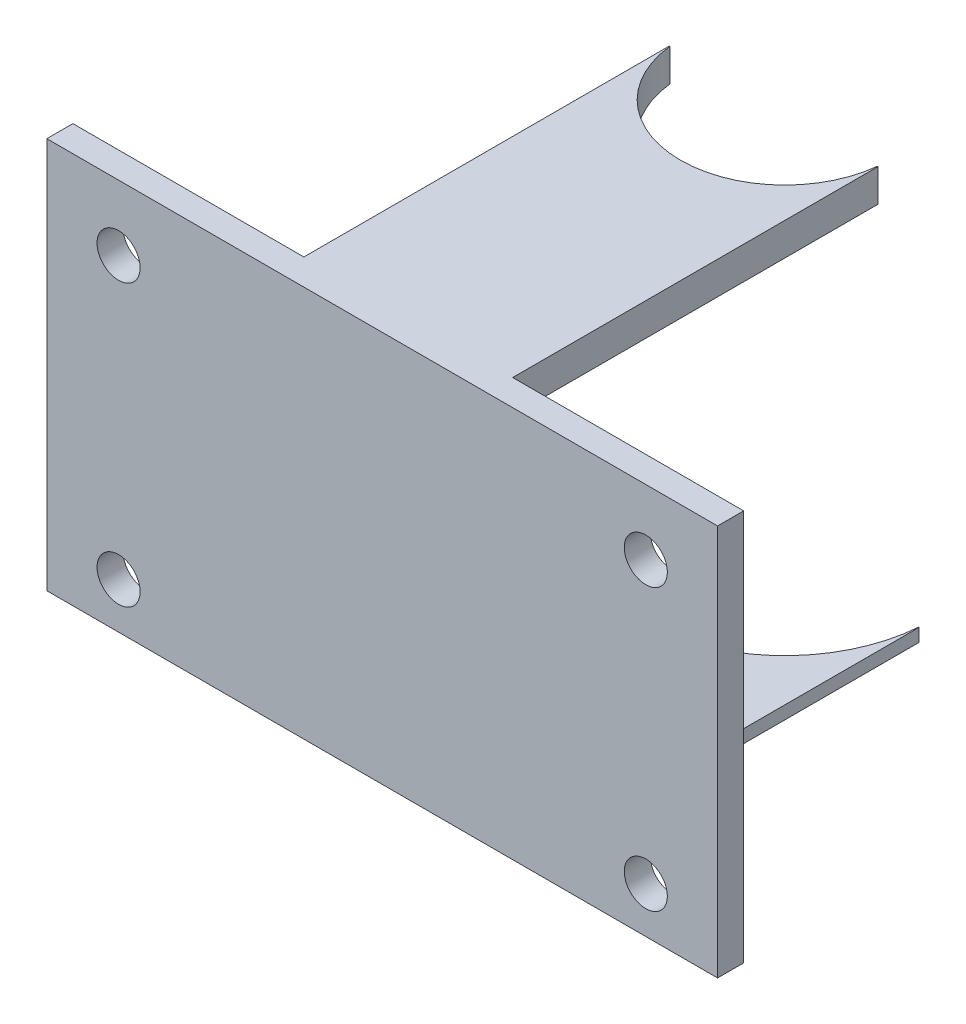
from build123d import *

# Parameters (mm, degrees)
SKETCH1_W           = 51.4
SKETCH1_H           = 30
BOSS_EXTRUDE1_DEPTH = 2
SKETCH2_R           = 1.65
CUT_EXTRUDE1_DEPTH  = 15
SKETCH3_W           = 16
SKETCH3_H           = 2.5
SKETCH3_W_2         = 22.3
SKETCH3_H_2         = 1
BOSS_EXTRUDE2_DEPTH = 28
SKETCH4_R           = 8
CUT_EXTRUDE3_DEPTH  = 10
SKETCH6_R           = 11.15
CUT_EXTRUDE4_DEPTH  = 10


with BuildPart() as part:
    # Sketch1 → Boss-Extrude1 (new body)
    with BuildSketch(Plane.XY):
        with Locations((25.7, 15)):
            Rectangle(SKETCH1_W, SKETCH1_H)
    extrude(amount=BOSS_EXTRUDE1_DEPTH)

    # Sketch2 → Cut-Extrude1 (cut)
    with BuildSketch(Plane(origin=(0, 0, 0), x_dir=(-1, 0, 0), z_dir=(0, 0, -1))):
        with Locations((-45.9, 25)):
            Circle(SKETCH2_R)
        with Locations((-5.5, 25)):
            Circle(SKETCH2_R)
        with Locations((-5.5, 3.5)):
            Circle(SKETCH2_R)
        with Locations((-45.9, 3.5)):
            Circle(SKETCH2_R)
    extrude(amount=-CUT_EXTRUDE1_DEPTH, mode=Mode.SUBTRACT)

    # Sketch3 → Boss-Extrude2 (add)
    with BuildSketch(Plane(origin=(0, 0, 0), x_dir=(-1, 0, 0), z_dir=(0, 0, -1))):
        with Locations((-25.7, 28.75)):
            Rectangle(SKETCH3_W, SKETCH3_H)
        with Locations((-25.7, 0.5)):
            Rectangle(SKETCH3_W_2, SKETCH3_H_2)
    extrude(amount=BOSS_EXTRUDE2_DEPTH)

    # Sketch4 → Cut-Extrude3 (cut)
    with BuildSketch(Plane(origin=(0, 30, 0), x_dir=(1, 0, 0), z_dir=(0, 1, 0))):
        with Locations((25.7, 28.85)):
            Circle(SKETCH4_R)
    extrude(amount=-CUT_EXTRUDE3_DEPTH, mode=Mode.SUBTRACT)

    # Sketch6 → Cut-Extrude4 (cut)
    with BuildSketch(Plane(origin=(0, 1, 0), x_dir=(1, 0, 0), z_dir=(0, 1, 0))):
        with Locations((25.7, 28.85)):
            Circle(SKETCH6_R)
    extrude(amount=-CUT_EXTRUDE4_DEPTH, mode=Mode.SUBTRACT)


solid = part.part
